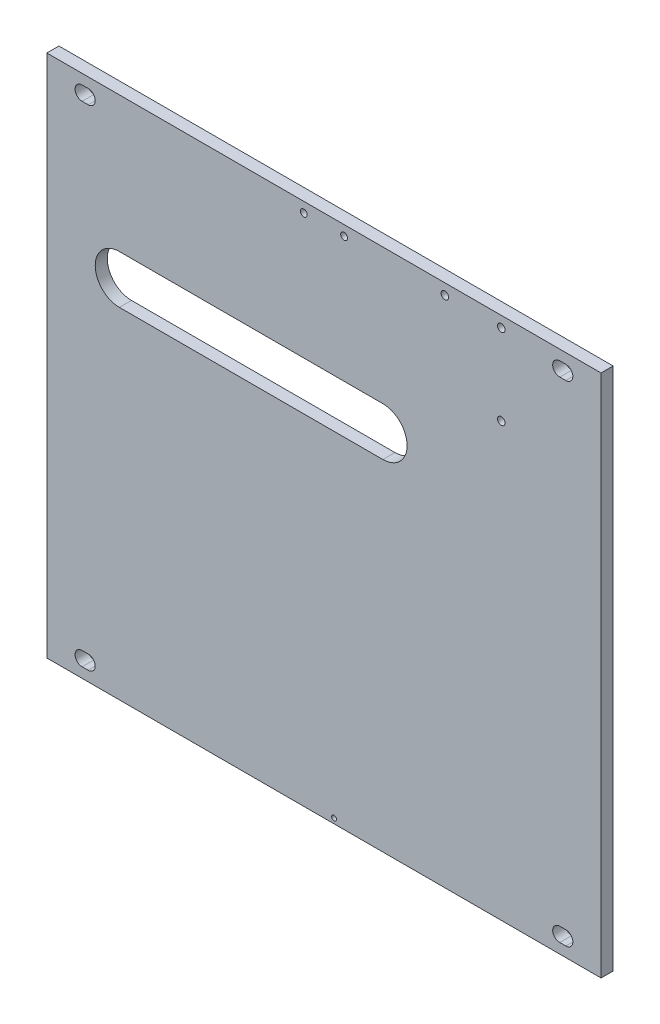
from build123d import *

# Parameters (mm, degrees)
CROQUIS1_W                      = 275
CROQUIS1_H                      = 260
BRIDA_BASE1_DEPTH               = 6
CORTAR_EXTRUIR1_DEPTH           = 190.320495457
CORTAR_EXTRUIR2_DEPTH           = 190.320495457
CORTAR_EXTRUIR2_DEPTH_BACK      = 190.320495457
CROQUIS3_R                      = 1.875
RANURA_START                    = -6
RANURA_DE_MARGEN_PARA_M61_DEPTH = 6
CROQUIS8_R                      = 1.2
CORTAR_EXTRUIR4_DEPTH           = 190.320495457
TALADRO_DE_MARGEN_PARA_M31_D    = 3.4


# Read off the part's stored shape, not the designer's step: Ranura de margen para M61
# Sheet-metal steps are written as plain solids
with BuildPart() as part:
    # Croquis1 → Brida base1 (new body)
    with BuildSketch(Plane.XY):
        Rectangle(CROQUIS1_W, CROQUIS1_H)
    extrude(amount=-BRIDA_BASE1_DEPTH)

    # Croquis2 → Cortar-Extruir1 (cut, through all)
    with BuildSketch(Plane.XY):
        with BuildLine():
            Line((-101.5, 38.67), (29.25, 38.67))
            ThreePointArc((29.25, 38.67), (41.25, 50.67), (29.25, 62.67))
            Line((29.25, 62.67), (-101.5, 62.67))
            ThreePointArc((-101.5, 62.67), (-113.5, 50.67), (-101.5, 38.67))
        make_face()
    extrude(amount=-CORTAR_EXTRUIR1_DEPTH, mode=Mode.SUBTRACT)

    # Croquis3 → Cortar-Extruir2 (cut, two sides: drawn at the far end of the back side and taken through both)
    with BuildSketch(Plane.XY.offset(-CORTAR_EXTRUIR2_DEPTH_BACK)):
        with Locations((88, 84.63)):
            Circle(CROQUIS3_R)
        with Locations((88, 124.63)):
            Circle(CROQUIS3_R)
        with Locations((60, 124.63)):
            Circle(CROQUIS3_R)
    extrude(amount=CORTAR_EXTRUIR2_DEPTH + CORTAR_EXTRUIR2_DEPTH_BACK, mode=Mode.SUBTRACT)

    # Ranura de margen para M61 outline → Ranura de margen para M61 (cut)
    with BuildSketch(Plane.XY.offset(RANURA_START)):
        with BuildLine():
            Line((120, 125), (117, 125))
            ThreePointArc((117, 125), (113.5, 121.5), (117, 118))
            Line((117, 118), (120, 118))
            ThreePointArc((120, 118), (123.5, 121.5), (120, 125))
        make_face()
        with BuildLine():
            ThreePointArc((-120, 125), (-123.5, 121.5), (-120, 118))
            Line((-120, 118), (-117, 118))
            ThreePointArc((-117, 118), (-113.5, 121.5), (-117, 125))
            Line((-117, 125), (-120, 125))
        make_face()
        with BuildLine():
            Line((-117, -118), (-120, -118))
            ThreePointArc((-120, -118), (-123.5, -121.5), (-120, -125))
            Line((-120, -125), (-117, -125))
            ThreePointArc((-117, -125), (-113.5, -121.5), (-117, -118))
        make_face()
        with BuildLine():
            ThreePointArc((117, -118), (113.5, -121.5), (117, -125))
            Line((117, -125), (120, -125))
            ThreePointArc((120, -125), (123.5, -121.5), (120, -118))
            Line((120, -118), (117, -118))
        make_face()
    extrude(amount=RANURA_DE_MARGEN_PARA_M61_DEPTH, mode=Mode.SUBTRACT)

    # Croquis8 → Cortar-Extruir4 (cut, through all)
    with BuildSketch(Plane.XY):
        with Locations((5, -127.5)):
            Circle(CROQUIS8_R)
    extrude(amount=-CORTAR_EXTRUIR4_DEPTH, mode=Mode.SUBTRACT)

    # Taladro de margen para M31 (through all)
    with Locations(Plane(origin=(0, 0, -6), x_dir=(-1, 0, 0), z_dir=(0, 0, -1))):
        with Locations((10, 125), (-10, 125)):
            Hole(TALADRO_DE_MARGEN_PARA_M31_D / 2)


solid = part.part
